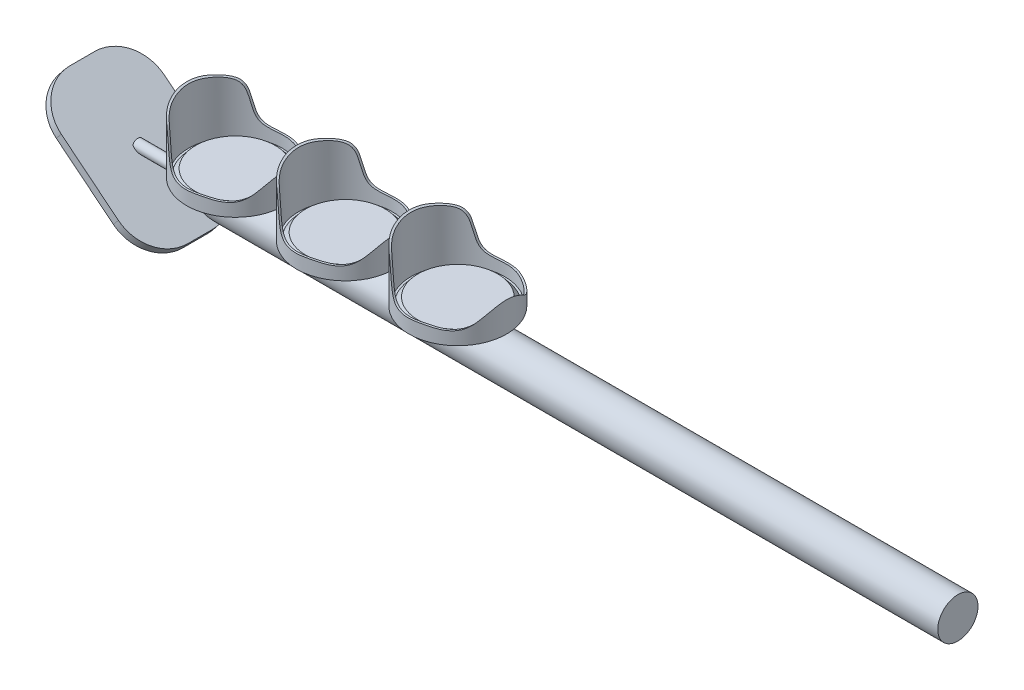
from build123d import *

# Parameters (mm, degrees)
IZIM1_R                               = 25
Y_KSEKLIK_EKSTR_ZYON1_DEPTH           = 30
Y_KSEKLIK_EKSTR_ZYON1_2_DEPTH         = 30
Y_KSEKLIK_EKSTR_ZYON1_3_DEPTH         = 30
KES_EKSTR_ZYON2_DEPTH                 = 165
KES_EKSTR_ZYON2_DEPTH_BACK            = 165
BO_ALTMA3_START                       = 1
BO_ALTMA3_OUTLINE_R                   = 24
BO_ALTMA3_DEPTH                       = 28.563282352
BO_ALTMA4_START                       = 1
BO_ALTMA4_OUTLINE_R                   = 24
BO_ALTMA4_DEPTH                       = 28.563927172
BO_ALTMA5_START                       = 1
BO_ALTMA5_OUTLINE_R                   = 24
BO_ALTMA5_DEPTH                       = 28.563693867
Y_KSEKLIK_EKSTR_ZYON3_DEPTH           = 370
Y_KSEKLIK_EKSTR_ZYON3_DEPTH_BACK      = 25
IZIM4_R                               = 10.304339076
KES_EKSTR_ZYON3_DEPTH                 = 279
KES_EKSTR_ZYON3_DEPTH_BACK            = 279
IZIM6_R                               = 2.72182929
Y_KSEKLIK_EKSTR_ZYON4_DEPTH           = 50
IZIM7_W                               = 77.580607531
IZIM7_H                               = 52.695927292
Y_KSEKLIK_EKSTR_ZYON5_DEPTH           = 4
RADYUS1_R                             = 20
IZIM9_R                               = 22.921195822
Y_KSEKLIK_EKSTR_ZYON7_DEPTH           = 3
Y_KSEKLIK_EKSTR_ZYON7_DRAFT           = 40
Y_KSEKLIK_EKSTR_ZYON7_PROFILE_2_DEPTH = 3
Y_KSEKLIK_EKSTR_ZYON7_PROFILE_2_DRAFT = 40
Y_KSEKLIK_EKSTR_ZYON7_PROFILE_3_DEPTH = 3
Y_KSEKLIK_EKSTR_ZYON7_PROFILE_3_DRAFT = 40


# Read off the part's stored shape, not the designer's step: İç Boşaltma3, İç Boşaltma4, İç Boşaltma5
with BuildPart() as part:
    # Çizim1 → Yükseklik-Ekstrüzyon1 (new body)
    with BuildSketch(Plane(origin=(0, 0, 0), x_dir=(1, 0, 0), z_dir=(0, 1, 0))):
        with Locations(Location((0, 0, 0), (0, 0, 270))):
            Circle(IZIM1_R)
    extrude(amount=Y_KSEKLIK_EKSTR_ZYON1_DEPTH)


with BuildPart() as body_2:
    # Çizim1 → Y_kseklik-Ekstr_zyon1 2 (new body)
    with BuildSketch(Plane(origin=(0, 0, 0), x_dir=(1, 0, 0), z_dir=(0, 1, 0))):
        with Locations(Location((56.351461774, 0, 0), (0, 0, 270))):
            Circle(IZIM1_R)
    extrude(amount=Y_KSEKLIK_EKSTR_ZYON1_2_DEPTH)


with BuildPart() as body_3:
    # Çizim1 → Y_kseklik-Ekstr_zyon1 3 (new body)
    with BuildSketch(Plane(origin=(0, 0, 0), x_dir=(1, 0, 0), z_dir=(0, 1, 0))):
        with Locations(Location((113.895949995, 0, 0), (0, 0, 270))):
            Circle(IZIM1_R)
    extrude(amount=Y_KSEKLIK_EKSTR_ZYON1_3_DEPTH)


with BuildPart() as kes_ekstr_zyon2_tool:
    # Çizim2 → Kes-Ekstrüzyon2 (new, two sides: drawn at the far end of the back side and taken through both)
    with BuildSketch(Plane.XY.offset(-KES_EKSTR_ZYON2_DEPTH_BACK)):
        with BuildLine():
            add(Edge.make_bspline(
                [(24.052891668, 42.794318946), (21.743511651, 47.141122226), (5.358143193, 63.859355923), (-48.094983859, 42.985980269), (-28.482258472, 30.881305919), (-24.62355306, 29.933585237), (-21.73084045, 28.225345042), (-11.282774333, 26.29074504), (-14.180841932, 7.468386821), (-0.174682388, 6.731705628), (8.696379561, 7.712839986), (18.755763492, 5.027556338), (24.178378425, 12.901551616), (27.228396065, 20.437148803), (27.708950685, 27.681989414), (27.332037184, 31.502342451)],
                knots=[0, 0, 0, 0, 0.082431261, 0.382170706, 0.432865672, 0.439578266, 0.449296643, 0.494787943, 0.60983152, 0.661191945, 0.711597337, 0.783212888, 0.815476541, 0.871356117, 0.934692158, 0.934692158, 0.934692158, 0.934692158], degree=3))
            add(Edge.make_bspline(
                [(27.332037184, 31.502342451), (28.469442923, 30.913677117), (29.943125628, 30.426486641), (31.879003774, 29.845913634), (34.619443647, 28.22312444), (45.069966823, 26.293157415), (42.170426795, 7.468022816), (56.176812296, 6.731767682), (65.047828159, 7.712815139), (75.107226939, 5.027559504), (80.529839578, 12.901550425), (83.653845025, 20.619946623), (84.088210831, 28.129844154), (83.611538248, 32.16696616)],
                knots=[0.42010968, 0.42010968, 0.42010968, 0.42010968, 0.441816154, 0.445307804, 0.455026181, 0.500517481, 0.615561057, 0.666921483, 0.717326875, 0.788942426, 0.821206079, 0.877085654, 0.94409623, 0.94409623, 0.94409623, 0.94409623], degree=3))
            add(Edge.make_bspline(
                [(83.611538248, 32.16696616), (85.024096556, 31.297418932), (86.974655555, 30.557191108), (89.385135997, 29.868041393), (92.164384059, 28.223912089), (102.613963747, 26.292301645), (99.714989547, 7.468152667), (113.721287271, 6.731744567), (122.592324121, 7.712828814), (132.651703237, 5.027537936), (138.074350324, 12.90159124), (144.098703448, 27.786046654), (136.096702933, 65.22482072), (87.042582324, 50.705249228), (80.868412091, 41.877755673)],
                knots=[0, 0, 0, 0, 0.02905254, 0.03336042, 0.043078797, 0.088570097, 0.203613673, 0.254974099, 0.305379491, 0.376995042, 0.409258695, 0.46513827, 0.676213415, 0.912096517, 0.912096517, 0.912096517, 0.912096517], degree=3))
            add(Edge.make_bspline(
                [(80.868412091, 41.877755673), (78.579862426, 46.632680163), (65.450411745, 60.849062726), (31.381263485, 51.176717157), (24.052891668, 42.794318946)],
                knots=[0, 0, 0, 0, 0.088160799, 0.315085603, 0.315085603, 0.315085603, 0.315085603], degree=3))
        make_face()
    extrude(amount=KES_EKSTR_ZYON2_DEPTH + KES_EKSTR_ZYON2_DEPTH_BACK)


with BuildPart() as part_1:
    add(part.part)

    # Kes-Ekstrüzyon2: cut by kes_ekstr_zyon2_tool
    add(kes_ekstr_zyon2_tool.part, mode=Mode.SUBTRACT)

    # İç Boşaltma3 outline → İç Boşaltma3 (cut)
    with BuildSketch(Plane(origin=(0, 0, 0), x_dir=(1, 0, 0), z_dir=(0, 1, 0)).offset(BO_ALTMA3_START)):
        Circle(BO_ALTMA3_OUTLINE_R)
    extrude(amount=BO_ALTMA3_DEPTH, mode=Mode.SUBTRACT)


with BuildPart() as body_2_1:
    add(body_2.part)

    # Kes-Ekstrüzyon2: cut by kes_ekstr_zyon2_tool
    add(kes_ekstr_zyon2_tool.part, mode=Mode.SUBTRACT)

    # İç Boşaltma4 outline → İç Boşaltma4 (cut)
    with BuildSketch(Plane(origin=(0, 0, 0), x_dir=(1, 0, 0), z_dir=(0, 1, 0)).offset(BO_ALTMA4_START)):
        with Locations((56.351461774, 0)):
            Circle(BO_ALTMA4_OUTLINE_R)
    extrude(amount=BO_ALTMA4_DEPTH, mode=Mode.SUBTRACT)


with BuildPart() as body_3_1:
    add(body_3.part)

    # Kes-Ekstrüzyon2: cut by kes_ekstr_zyon2_tool
    add(kes_ekstr_zyon2_tool.part, mode=Mode.SUBTRACT)

    # İç Boşaltma5 outline → İç Boşaltma5 (cut)
    with BuildSketch(Plane(origin=(0, 0, 0), x_dir=(1, 0, 0), z_dir=(0, 1, 0)).offset(BO_ALTMA5_START)):
        with Locations((113.895949995, 0)):
            Circle(BO_ALTMA5_OUTLINE_R)
    extrude(amount=BO_ALTMA5_DEPTH, mode=Mode.SUBTRACT)


with BuildPart() as body_4:
    # Çizim4 → Yükseklik-Ekstrüzyon3 (new, two sides: drawn at the far end of the back side and taken through both)
    with BuildSketch(Plane(origin=(0, 0, 0), x_dir=(0, 0, -1), z_dir=(1, 0, 0)).offset(-Y_KSEKLIK_EKSTR_ZYON3_DEPTH_BACK)):
        with Locations((0, -10.304339076)):
            Circle(IZIM4_R)
    extrude(amount=Y_KSEKLIK_EKSTR_ZYON3_DEPTH + Y_KSEKLIK_EKSTR_ZYON3_DEPTH_BACK)

    # Çizim5 → Kes-Ekstrüzyon3 (cut, two sides: drawn at the far end of the back side and taken through both)
    with BuildSketch(Plane.XY.offset(-KES_EKSTR_ZYON3_DEPTH_BACK)):
        Polygon((-25, 0), (0.544350642, -20.608678151), (-25, -20.608678151), align=None)
    extrude(amount=KES_EKSTR_ZYON3_DEPTH + KES_EKSTR_ZYON3_DEPTH_BACK, mode=Mode.SUBTRACT)

    # Çizim6 → Yükseklik-Ekstrüzyon4 (add)
    with BuildSketch(Plane(origin=(0, 0, 0), x_dir=(0, 0, -1), z_dir=(1, 0, 0))):
        with Locations((0, -10.304339076)):
            Circle(IZIM6_R)
    extrude(amount=-Y_KSEKLIK_EKSTR_ZYON4_DEPTH)


with BuildPart() as body_5:
    # Çizim7 → Yükseklik-Ekstrüzyon5 (new body)
    with BuildSketch(Plane(origin=(-24.304873932, -30.125766315, 0), x_dir=(-0.7782880315020403, 0.6279074294995076, 0), z_dir=(-0.6279074294995076, -0.7782880315020403, 0))):
        with Locations((30.735173681, 0)):
            Rectangle(IZIM7_W, IZIM7_H)
    extrude(amount=Y_KSEKLIK_EKSTR_ZYON5_DEPTH)

    # Radyus1
    radyus1_edges = [body_5.edges().sort_by_distance(p)[0] for p in [
        (-19.291477454, -36.740218403, -26.347963646),
        (-79.671535772, 11.97322145, -26.347963646),
        (-79.671535772, 11.97322145, 26.347963646),
        (-19.291477454, -36.740218403, 26.347963646),
    ]]
    fillet(radyus1_edges, radius=RADYUS1_R)


with BuildPart() as body_6:
    # Çizim9 → Yükseklik-Ekstrüzyon7 (with draft: the straight prism first)
    with BuildSketch(Plane(origin=(0, 1, 0), x_dir=(1, 0, 0), z_dir=(0, 1, 0))):
        Circle(IZIM9_R)
    extrude(amount=Y_KSEKLIK_EKSTR_ZYON7_DEPTH)
    # Yükseklik-Ekstrüzyon7: the draft: its side faces are tilted about the plane it starts from
    y_kseklik_ekstr_zyon7_sides = [body_6.faces().sort_by_distance(p)[0] for p in [
        (-22.921195822, 2.5, 0),
    ]]
    draft(y_kseklik_ekstr_zyon7_sides, Plane(origin=(0, 1, 0), x_dir=(1, 0, 0), z_dir=(0, 1, 0)), Y_KSEKLIK_EKSTR_ZYON7_DRAFT)


with BuildPart() as body_7:
    # Çizim9 → Yükseklik-Ekstrüzyon7 profile 2 (with draft: the straight prism first)
    with BuildSketch(Plane(origin=(0, 1, 0), x_dir=(1, 0, 0), z_dir=(0, 1, 0))):
        with Locations((56.351461774, 0)):
            Circle(IZIM9_R)
    extrude(amount=Y_KSEKLIK_EKSTR_ZYON7_PROFILE_2_DEPTH)
    # Yükseklik-Ekstrüzyon7 profile 2: the draft: its side faces are tilted about the plane it starts from
    y_kseklik_ekstr_zyon7_profile_2_sides = [body_7.faces().sort_by_distance(p)[0] for p in [
        (33.430265952, 2.5, 0),
    ]]
    draft(y_kseklik_ekstr_zyon7_profile_2_sides, Plane(origin=(0, 1, 0), x_dir=(1, 0, 0), z_dir=(0, 1, 0)), Y_KSEKLIK_EKSTR_ZYON7_PROFILE_2_DRAFT)


with BuildPart() as body_8:
    # Çizim9 → Yükseklik-Ekstrüzyon7 profile 3 (with draft: the straight prism first)
    with BuildSketch(Plane(origin=(0, 1, 0), x_dir=(1, 0, 0), z_dir=(0, 1, 0))):
        with Locations((113.895949995, 0)):
            Circle(IZIM9_R)
    extrude(amount=Y_KSEKLIK_EKSTR_ZYON7_PROFILE_3_DEPTH)
    # Yükseklik-Ekstrüzyon7 profile 3: the draft: its side faces are tilted about the plane it starts from
    y_kseklik_ekstr_zyon7_profile_3_sides = [body_8.faces().sort_by_distance(p)[0] for p in [
        (90.974754173, 2.5, 0),
    ]]
    draft(y_kseklik_ekstr_zyon7_profile_3_sides, Plane(origin=(0, 1, 0), x_dir=(1, 0, 0), z_dir=(0, 1, 0)), Y_KSEKLIK_EKSTR_ZYON7_PROFILE_3_DRAFT)


solid = Compound([part_1.part, body_2_1.part, body_3_1.part, body_4.part, body_5.part, body_6.part, body_7.part, body_8.part])
